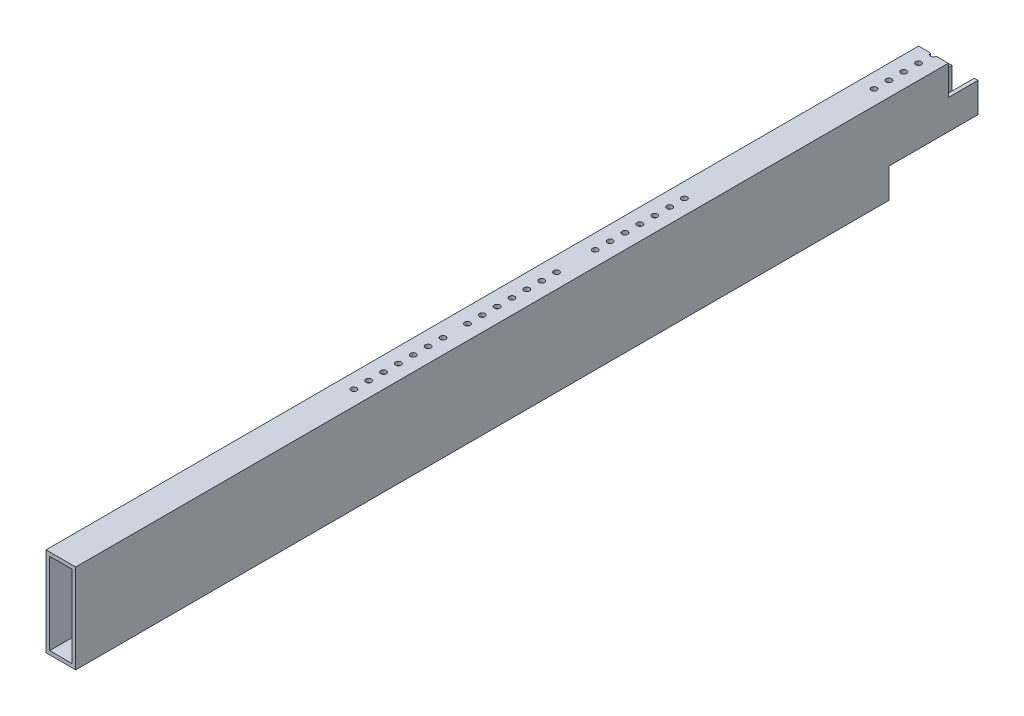
from build123d import *

# Parameters (mm, degrees)
SKETCH1_W           = 25.4
SKETCH1_H           = 76.2
BOSS_EXTRUDE1_DEPTH = 385.699
SHELL1_T            = -3.175
SKETCH2_W           = 76.2
SKETCH2_H           = 25.4
CUT_EXTRUDE1_DEPTH  = 389.407632007
SKETCH3_W           = 25.4
SKETCH3_H           = 25.4
CUT_EXTRUDE2_DEPTH  = 389.407632007
CUT_EXTRUDE3_REACH  = 395.359
SKETCH4_R           = 2.38125
CUT_EXTRUDE4_REACH  = 395.359
SKETCH5_R           = 2.38125
CUT_EXTRUDE5_REACH  = 395.359
SKETCH6_R           = 2.38125


with BuildPart() as part:
    # Sketch1 → Boss-Extrude1 (new, symmetric)
    with BuildSketch(Plane.XY):
        Rectangle(SKETCH1_W, SKETCH1_H)
    extrude(amount=BOSS_EXTRUDE1_DEPTH, both=True)

    # Shell1
    shell1_openings = [part.faces().sort_by_distance(p)[0] for p in [
        (0, 0, -385.699),
        (0, 0, 385.699),
    ]]
    offset(amount=SHELL1_T, openings=shell1_openings, kind=Kind.INTERSECTION)

    # Sketch2 → Cut-Extrude1 (cut, through all)
    with BuildSketch(Plane(origin=(12.7, 0, 0), x_dir=(0, 0, -1), z_dir=(1, 0, 0))):
        with Locations((347.599, -25.4)):
            Rectangle(SKETCH2_W, SKETCH2_H)
    extrude(amount=-CUT_EXTRUDE1_DEPTH, mode=Mode.SUBTRACT)

    # Sketch3 → Cut-Extrude2 (cut, through all)
    with BuildSketch(Plane(origin=(12.7, 0, 0), x_dir=(0, 0, -1), z_dir=(1, 0, 0))):
        with Locations((372.999, 25.4)):
            Rectangle(SKETCH3_W, SKETCH3_H)
    extrude(amount=-CUT_EXTRUDE2_DEPTH, mode=Mode.SUBTRACT)

    # Sketch4 → Cut-Extrude3 (cut, up to next)
    with BuildSketch(Plane(origin=(0, 38.1, 0), x_dir=(1, 0, 0), z_dir=(0, 1, 0)), mode=Mode.PRIVATE) as cut_extrude3_sk1:
        with Locations((0, 147.394483214)):
            Circle(SKETCH4_R)
    cut_extrude3_tool1 = extrude(cut_extrude3_sk1.sketch, amount=-CUT_EXTRUDE3_REACH, mode=Mode.PRIVATE) & part.part
    # Sketch4 → Cut-Extrude3 (cut, up to next)
    with BuildSketch(Plane(origin=(0, 38.1, 0), x_dir=(1, 0, 0), z_dir=(0, 1, 0)), mode=Mode.PRIVATE) as cut_extrude3_sk2:
        with Locations((0, 134.694483214)):
            Circle(SKETCH4_R)
    cut_extrude3_tool2 = extrude(cut_extrude3_sk2.sketch, amount=-CUT_EXTRUDE3_REACH, mode=Mode.PRIVATE) & part.part
    # Sketch4 → Cut-Extrude3 (cut, up to next)
    with BuildSketch(Plane(origin=(0, 38.1, 0), x_dir=(1, 0, 0), z_dir=(0, 1, 0)), mode=Mode.PRIVATE) as cut_extrude3_sk3:
        with Locations((0, 121.994483214)):
            Circle(SKETCH4_R)
    cut_extrude3_tool3 = extrude(cut_extrude3_sk3.sketch, amount=-CUT_EXTRUDE3_REACH, mode=Mode.PRIVATE) & part.part
    # Sketch4 → Cut-Extrude3 (cut, up to next)
    with BuildSketch(Plane(origin=(0, 38.1, 0), x_dir=(1, 0, 0), z_dir=(0, 1, 0)), mode=Mode.PRIVATE) as cut_extrude3_sk4:
        with Locations((0, 109.294483214)):
            Circle(SKETCH4_R)
    cut_extrude3_tool4 = extrude(cut_extrude3_sk4.sketch, amount=-CUT_EXTRUDE3_REACH, mode=Mode.PRIVATE) & part.part
    # Sketch4 → Cut-Extrude3 (cut, up to next)
    with BuildSketch(Plane(origin=(0, 38.1, 0), x_dir=(1, 0, 0), z_dir=(0, 1, 0)), mode=Mode.PRIVATE) as cut_extrude3_sk5:
        with Locations((0, 96.594483214)):
            Circle(SKETCH4_R)
    cut_extrude3_tool5 = extrude(cut_extrude3_sk5.sketch, amount=-CUT_EXTRUDE3_REACH, mode=Mode.PRIVATE) & part.part
    # Sketch4 → Cut-Extrude3 (cut, up to next)
    with BuildSketch(Plane(origin=(0, 38.1, 0), x_dir=(1, 0, 0), z_dir=(0, 1, 0)), mode=Mode.PRIVATE) as cut_extrude3_sk6:
        with Locations((0, 83.894483214)):
            Circle(SKETCH4_R)
    cut_extrude3_tool6 = extrude(cut_extrude3_sk6.sketch, amount=-CUT_EXTRUDE3_REACH, mode=Mode.PRIVATE) & part.part
    # Sketch4 → Cut-Extrude3 (cut, up to next)
    with BuildSketch(Plane(origin=(0, 38.1, 0), x_dir=(1, 0, 0), z_dir=(0, 1, 0)), mode=Mode.PRIVATE) as cut_extrude3_sk7:
        with Locations((0, 71.194483214)):
            Circle(SKETCH4_R)
    cut_extrude3_tool7 = extrude(cut_extrude3_sk7.sketch, amount=-CUT_EXTRUDE3_REACH, mode=Mode.PRIVATE) & part.part
    # Sketch4 → Cut-Extrude3 (cut, up to next)
    with BuildSketch(Plane(origin=(0, 38.1, 0), x_dir=(1, 0, 0), z_dir=(0, 1, 0)), mode=Mode.PRIVATE) as cut_extrude3_sk8:
        with Locations((0, 38.09873)):
            Circle(SKETCH4_R)
    cut_extrude3_tool8 = extrude(cut_extrude3_sk8.sketch, amount=-CUT_EXTRUDE3_REACH, mode=Mode.PRIVATE) & part.part
    # Sketch4 → Cut-Extrude3 (cut, up to next)
    with BuildSketch(Plane(origin=(0, 38.1, 0), x_dir=(1, 0, 0), z_dir=(0, 1, 0)), mode=Mode.PRIVATE) as cut_extrude3_sk9:
        with Locations((0, 25.39873)):
            Circle(SKETCH4_R)
    cut_extrude3_tool9 = extrude(cut_extrude3_sk9.sketch, amount=-CUT_EXTRUDE3_REACH, mode=Mode.PRIVATE) & part.part
    # Sketch4 → Cut-Extrude3 (cut, up to next)
    with BuildSketch(Plane(origin=(0, 38.1, 0), x_dir=(1, 0, 0), z_dir=(0, 1, 0)), mode=Mode.PRIVATE) as cut_extrude3_sk10:
        with Locations((0, 12.69873)):
            Circle(SKETCH4_R)
    cut_extrude3_tool10 = extrude(cut_extrude3_sk10.sketch, amount=-CUT_EXTRUDE3_REACH, mode=Mode.PRIVATE) & part.part
    # Sketch4 → Cut-Extrude3 (cut, up to next)
    with BuildSketch(Plane(origin=(0, 38.1, 0), x_dir=(1, 0, 0), z_dir=(0, 1, 0)), mode=Mode.PRIVATE) as cut_extrude3_sk11:
        with Locations((0, -0.00127)):
            Circle(SKETCH4_R)
    cut_extrude3_tool11 = extrude(cut_extrude3_sk11.sketch, amount=-CUT_EXTRUDE3_REACH, mode=Mode.PRIVATE) & part.part
    # Sketch4 → Cut-Extrude3 (cut, up to next)
    with BuildSketch(Plane(origin=(0, 38.1, 0), x_dir=(1, 0, 0), z_dir=(0, 1, 0)), mode=Mode.PRIVATE) as cut_extrude3_sk12:
        with Locations((0, -12.70127)):
            Circle(SKETCH4_R)
    cut_extrude3_tool12 = extrude(cut_extrude3_sk12.sketch, amount=-CUT_EXTRUDE3_REACH, mode=Mode.PRIVATE) & part.part
    # Sketch4 → Cut-Extrude3 (cut, up to next)
    with BuildSketch(Plane(origin=(0, 38.1, 0), x_dir=(1, 0, 0), z_dir=(0, 1, 0)), mode=Mode.PRIVATE) as cut_extrude3_sk13:
        with Locations((0, -25.40127)):
            Circle(SKETCH4_R)
    cut_extrude3_tool13 = extrude(cut_extrude3_sk13.sketch, amount=-CUT_EXTRUDE3_REACH, mode=Mode.PRIVATE) & part.part
    # Sketch4 → Cut-Extrude3 (cut, up to next)
    with BuildSketch(Plane(origin=(0, 38.1, 0), x_dir=(1, 0, 0), z_dir=(0, 1, 0)), mode=Mode.PRIVATE) as cut_extrude3_sk14:
        with Locations((0, -38.10127)):
            Circle(SKETCH4_R)
    cut_extrude3_tool14 = extrude(cut_extrude3_sk14.sketch, amount=-CUT_EXTRUDE3_REACH, mode=Mode.PRIVATE) & part.part
    # Sketch4 → Cut-Extrude3 (cut, up to next)
    with BuildSketch(Plane(origin=(0, 38.1, 0), x_dir=(1, 0, 0), z_dir=(0, 1, 0)), mode=Mode.PRIVATE) as cut_extrude3_sk15:
        with Locations((0, -58.99324371)):
            Circle(SKETCH4_R)
    cut_extrude3_tool15 = extrude(cut_extrude3_sk15.sketch, amount=-CUT_EXTRUDE3_REACH, mode=Mode.PRIVATE) & part.part
    # Sketch4 → Cut-Extrude3 (cut, up to next)
    with BuildSketch(Plane(origin=(0, 38.1, 0), x_dir=(1, 0, 0), z_dir=(0, 1, 0)), mode=Mode.PRIVATE) as cut_extrude3_sk16:
        with Locations((0, -71.69324371)):
            Circle(SKETCH4_R)
    cut_extrude3_tool16 = extrude(cut_extrude3_sk16.sketch, amount=-CUT_EXTRUDE3_REACH, mode=Mode.PRIVATE) & part.part
    # Sketch4 → Cut-Extrude3 (cut, up to next)
    with BuildSketch(Plane(origin=(0, 38.1, 0), x_dir=(1, 0, 0), z_dir=(0, 1, 0)), mode=Mode.PRIVATE) as cut_extrude3_sk17:
        with Locations((0, -84.39324371)):
            Circle(SKETCH4_R)
    cut_extrude3_tool17 = extrude(cut_extrude3_sk17.sketch, amount=-CUT_EXTRUDE3_REACH, mode=Mode.PRIVATE) & part.part
    # Sketch4 → Cut-Extrude3 (cut, up to next)
    with BuildSketch(Plane(origin=(0, 38.1, 0), x_dir=(1, 0, 0), z_dir=(0, 1, 0)), mode=Mode.PRIVATE) as cut_extrude3_sk18:
        with Locations((0, -97.09324371)):
            Circle(SKETCH4_R)
    cut_extrude3_tool18 = extrude(cut_extrude3_sk18.sketch, amount=-CUT_EXTRUDE3_REACH, mode=Mode.PRIVATE) & part.part
    # Sketch4 → Cut-Extrude3 (cut, up to next)
    with BuildSketch(Plane(origin=(0, 38.1, 0), x_dir=(1, 0, 0), z_dir=(0, 1, 0)), mode=Mode.PRIVATE) as cut_extrude3_sk19:
        with Locations((0, -109.79324371)):
            Circle(SKETCH4_R)
    cut_extrude3_tool19 = extrude(cut_extrude3_sk19.sketch, amount=-CUT_EXTRUDE3_REACH, mode=Mode.PRIVATE) & part.part
    # Sketch4 → Cut-Extrude3 (cut, up to next)
    with BuildSketch(Plane(origin=(0, 38.1, 0), x_dir=(1, 0, 0), z_dir=(0, 1, 0)), mode=Mode.PRIVATE) as cut_extrude3_sk20:
        with Locations((0, -122.49324371)):
            Circle(SKETCH4_R)
    cut_extrude3_tool20 = extrude(cut_extrude3_sk20.sketch, amount=-CUT_EXTRUDE3_REACH, mode=Mode.PRIVATE) & part.part
    # Sketch4 → Cut-Extrude3 (cut, up to next)
    with BuildSketch(Plane(origin=(0, 38.1, 0), x_dir=(1, 0, 0), z_dir=(0, 1, 0)), mode=Mode.PRIVATE) as cut_extrude3_sk21:
        with Locations((0, -135.19324371)):
            Circle(SKETCH4_R)
    cut_extrude3_tool21 = extrude(cut_extrude3_sk21.sketch, amount=-CUT_EXTRUDE3_REACH, mode=Mode.PRIVATE) & part.part
    add(cut_extrude3_tool1.solids().sort_by_distance((0, 38.1, -147.394483))[0], mode=Mode.SUBTRACT)
    add(cut_extrude3_tool2.solids().sort_by_distance((0, 38.1, -134.694483))[0], mode=Mode.SUBTRACT)
    add(cut_extrude3_tool3.solids().sort_by_distance((0, 38.1, -121.994483))[0], mode=Mode.SUBTRACT)
    add(cut_extrude3_tool4.solids().sort_by_distance((0, 38.1, -109.294483))[0], mode=Mode.SUBTRACT)
    add(cut_extrude3_tool5.solids().sort_by_distance((0, 38.1, -96.594483))[0], mode=Mode.SUBTRACT)
    add(cut_extrude3_tool6.solids().sort_by_distance((0, 38.1, -83.894483))[0], mode=Mode.SUBTRACT)
    add(cut_extrude3_tool7.solids().sort_by_distance((0, 38.1, -71.194483))[0], mode=Mode.SUBTRACT)
    add(cut_extrude3_tool8.solids().sort_by_distance((0, 38.1, -38.09873))[0], mode=Mode.SUBTRACT)
    add(cut_extrude3_tool9.solids().sort_by_distance((0, 38.1, -25.39873))[0], mode=Mode.SUBTRACT)
    add(cut_extrude3_tool10.solids().sort_by_distance((0, 38.1, -12.69873))[0], mode=Mode.SUBTRACT)
    add(cut_extrude3_tool11.solids().sort_by_distance((0, 38.1, 0.00127))[0], mode=Mode.SUBTRACT)
    add(cut_extrude3_tool12.solids().sort_by_distance((0, 38.1, 12.70127))[0], mode=Mode.SUBTRACT)
    add(cut_extrude3_tool13.solids().sort_by_distance((0, 38.1, 25.40127))[0], mode=Mode.SUBTRACT)
    add(cut_extrude3_tool14.solids().sort_by_distance((0, 38.1, 38.10127))[0], mode=Mode.SUBTRACT)
    add(cut_extrude3_tool15.solids().sort_by_distance((0, 38.1, 58.993244))[0], mode=Mode.SUBTRACT)
    add(cut_extrude3_tool16.solids().sort_by_distance((0, 38.1, 71.693244))[0], mode=Mode.SUBTRACT)
    add(cut_extrude3_tool17.solids().sort_by_distance((0, 38.1, 84.393244))[0], mode=Mode.SUBTRACT)
    add(cut_extrude3_tool18.solids().sort_by_distance((0, 38.1, 97.093244))[0], mode=Mode.SUBTRACT)
    add(cut_extrude3_tool19.solids().sort_by_distance((0, 38.1, 109.793244))[0], mode=Mode.SUBTRACT)
    add(cut_extrude3_tool20.solids().sort_by_distance((0, 38.1, 122.493244))[0], mode=Mode.SUBTRACT)
    add(cut_extrude3_tool21.solids().sort_by_distance((0, 38.1, 135.193244))[0], mode=Mode.SUBTRACT)

    # Sketch5 → Cut-Extrude4 (cut, up to next)
    with BuildSketch(Plane(origin=(0, 38.1, 0), x_dir=(1, 0, 0), z_dir=(0, 1, 0)), mode=Mode.PRIVATE) as cut_extrude4_sk1:
        with Locations((0, 360.299)):
            Circle(SKETCH5_R)
    cut_extrude4_tool1 = extrude(cut_extrude4_sk1.sketch, amount=-CUT_EXTRUDE4_REACH, mode=Mode.PRIVATE) & part.part
    # Sketch5 → Cut-Extrude4 (cut, up to next)
    with BuildSketch(Plane(origin=(0, 38.1, 0), x_dir=(1, 0, 0), z_dir=(0, 1, 0)), mode=Mode.PRIVATE) as cut_extrude4_sk2:
        with Locations((0, 347.599)):
            Circle(SKETCH5_R)
    cut_extrude4_tool2 = extrude(cut_extrude4_sk2.sketch, amount=-CUT_EXTRUDE4_REACH, mode=Mode.PRIVATE) & part.part
    # Sketch5 → Cut-Extrude4 (cut, up to next)
    with BuildSketch(Plane(origin=(0, 38.1, 0), x_dir=(1, 0, 0), z_dir=(0, 1, 0)), mode=Mode.PRIVATE) as cut_extrude4_sk3:
        with Locations((0, 334.899)):
            Circle(SKETCH5_R)
    cut_extrude4_tool3 = extrude(cut_extrude4_sk3.sketch, amount=-CUT_EXTRUDE4_REACH, mode=Mode.PRIVATE) & part.part
    # Sketch5 → Cut-Extrude4 (cut, up to next)
    with BuildSketch(Plane(origin=(0, 38.1, 0), x_dir=(1, 0, 0), z_dir=(0, 1, 0)), mode=Mode.PRIVATE) as cut_extrude4_sk4:
        with Locations((0, 322.199)):
            Circle(SKETCH5_R)
    cut_extrude4_tool4 = extrude(cut_extrude4_sk4.sketch, amount=-CUT_EXTRUDE4_REACH, mode=Mode.PRIVATE) & part.part
    # Sketch5 → Cut-Extrude4 (cut, up to next)
    with BuildSketch(Plane(origin=(0, 38.1, 0), x_dir=(1, 0, 0), z_dir=(0, 1, 0)), mode=Mode.PRIVATE) as cut_extrude4_sk5:
        with Locations((0, 309.499)):
            Circle(SKETCH5_R)
    cut_extrude4_tool5 = extrude(cut_extrude4_sk5.sketch, amount=-CUT_EXTRUDE4_REACH, mode=Mode.PRIVATE) & part.part
    add(cut_extrude4_tool1.solids().sort_by_distance((0, 38.1, -360.299))[0], mode=Mode.SUBTRACT)
    add(cut_extrude4_tool2.solids().sort_by_distance((0, 38.1, -347.599))[0], mode=Mode.SUBTRACT)
    add(cut_extrude4_tool3.solids().sort_by_distance((0, 38.1, -334.899))[0], mode=Mode.SUBTRACT)
    add(cut_extrude4_tool4.solids().sort_by_distance((0, 38.1, -322.199))[0], mode=Mode.SUBTRACT)
    add(cut_extrude4_tool5.solids().sort_by_distance((0, 38.1, -309.499))[0], mode=Mode.SUBTRACT)

    # Sketch6 → Cut-Extrude5 (cut, up to next)
    with BuildSketch(Plane.XZ.offset(38.1), mode=Mode.PRIVATE) as cut_extrude5_sk1:
        with Locations((0, -309.499)):
            Circle(SKETCH6_R)
    cut_extrude5_tool1 = extrude(cut_extrude5_sk1.sketch, amount=-CUT_EXTRUDE5_REACH, mode=Mode.PRIVATE) & part.part
    # Sketch6 → Cut-Extrude5 (cut, up to next)
    with BuildSketch(Plane.XZ.offset(38.1), mode=Mode.PRIVATE) as cut_extrude5_sk2:
        with Locations((0, -296.799)):
            Circle(SKETCH6_R)
    cut_extrude5_tool2 = extrude(cut_extrude5_sk2.sketch, amount=-CUT_EXTRUDE5_REACH, mode=Mode.PRIVATE) & part.part
    # Sketch6 → Cut-Extrude5 (cut, up to next)
    with BuildSketch(Plane.XZ.offset(38.1), mode=Mode.PRIVATE) as cut_extrude5_sk3:
        with Locations((0, -284.099)):
            Circle(SKETCH6_R)
    cut_extrude5_tool3 = extrude(cut_extrude5_sk3.sketch, amount=-CUT_EXTRUDE5_REACH, mode=Mode.PRIVATE) & part.part
    # Sketch6 → Cut-Extrude5 (cut, up to next)
    with BuildSketch(Plane.XZ.offset(38.1), mode=Mode.PRIVATE) as cut_extrude5_sk4:
        with Locations((0, -258.699)):
            Circle(SKETCH6_R)
    cut_extrude5_tool4 = extrude(cut_extrude5_sk4.sketch, amount=-CUT_EXTRUDE5_REACH, mode=Mode.PRIVATE) & part.part
    # Sketch6 → Cut-Extrude5 (cut, up to next)
    with BuildSketch(Plane.XZ.offset(38.1), mode=Mode.PRIVATE) as cut_extrude5_sk5:
        with Locations((0, -271.399)):
            Circle(SKETCH6_R)
    cut_extrude5_tool5 = extrude(cut_extrude5_sk5.sketch, amount=-CUT_EXTRUDE5_REACH, mode=Mode.PRIVATE) & part.part
    add(cut_extrude5_tool1.solids().sort_by_distance((0, -38.1, -309.499))[0], mode=Mode.SUBTRACT)
    add(cut_extrude5_tool2.solids().sort_by_distance((0, -38.1, -296.799))[0], mode=Mode.SUBTRACT)
    add(cut_extrude5_tool3.solids().sort_by_distance((0, -38.1, -284.099))[0], mode=Mode.SUBTRACT)
    add(cut_extrude5_tool4.solids().sort_by_distance((0, -38.1, -258.699))[0], mode=Mode.SUBTRACT)
    add(cut_extrude5_tool5.solids().sort_by_distance((0, -38.1, -271.399))[0], mode=Mode.SUBTRACT)


solid = part.part
